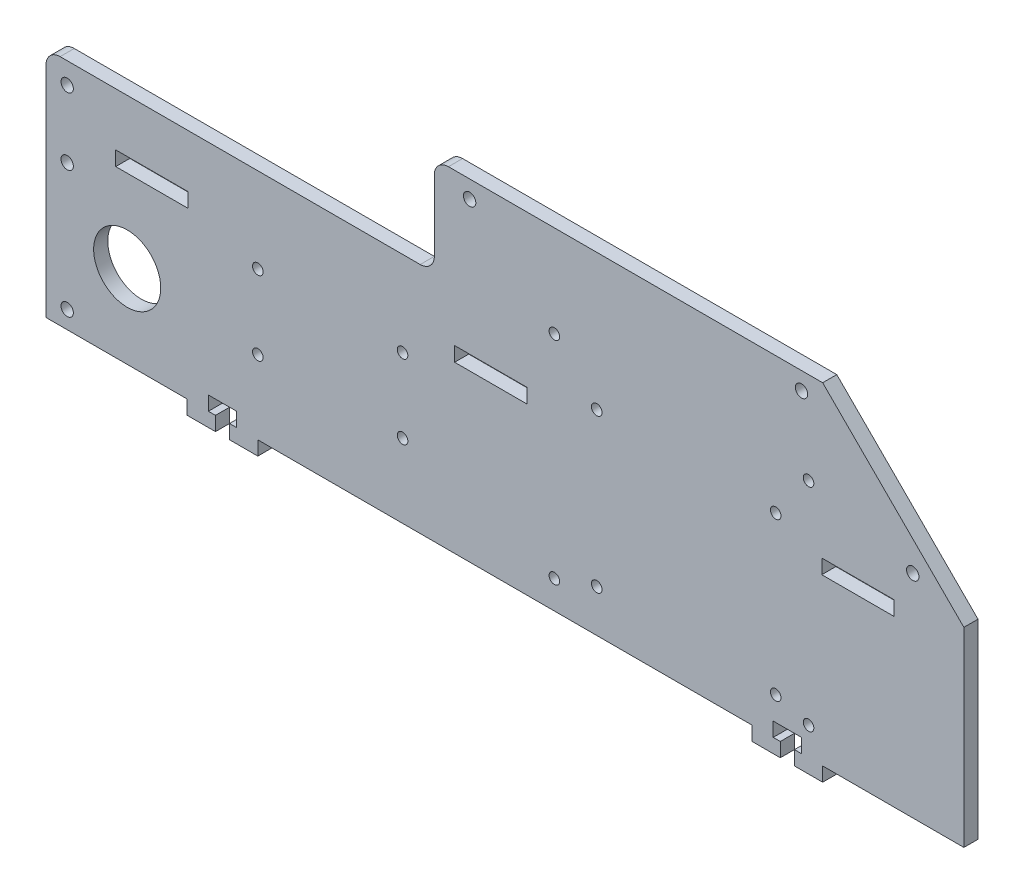
from build123d import *

# Parameters (mm, degrees)
SKETCH_1_R             = 9.5
SKETCH_1_R_2           = 1.5
SKETCH_1_W             = 20.5
SKETCH_1_H             = 4.1
SM_BASE_FLANGE_1_DEPTH = 4
SKETCH_6_R             = 1.75
CUT_EXTRUDE_1_DEPTH    = 267.640207021
SKETCH_8_R             = 1
SKETCH_8_R_2           = 0.822154456
CUT_EXTRUDE_3_DEPTH    = 10
CUT_EXTRUDE_4_REACH    = 268.64
SKETCH_9_R             = 1.5


# Sheet-metal steps are written as plain solids
with BuildPart() as part:
    # Sketch 1 → Базовая кромка1 (new body)
    with BuildSketch(Plane.XY):
        with BuildLine():
            Line((52, -59), (60, -59))
            Line((60, -59), (60, -55))
            Line((60, -55), (200, -55))
            Line((200, -55), (200, -59))
            Line((200, -59), (208, -59))
            Line((208, -59), (208, -55))
            Line((208, -55), (206, -55))
            Line((206, -55), (206, -51))
            Line((206, -51), (214, -51))
            Line((214, -51), (214, -55))
            Line((214, -55), (212, -55))
            Line((212, -55), (212, -59))
            Line((212, -59), (220, -59))
            Line((220, -59), (220, -55))
            Line((220, -55), (260, -55))
            Line((260, -55), (260, -1))
            Line((260, -1), (220, 39))
            Line((220, 39), (120, 39))
            Line((120, 39), (114, 39))
            ThreePointArc((114, 39), (111.171572875, 37.828427125), (110, 35))
            Line((110, 35), (110, 15))
            ThreePointArc((110, 15), (108.828427125, 12.171572875), (106, 11))
            Line((106, 11), (4, 11))
            ThreePointArc((4, 11), (1.171572875, 9.828427125), (0, 7))
            Line((0, 7), (0, 0))
            Line((0, 0), (0, -55))
            Line((0, -55), (40, -55))
            Line((40, -55), (40, -59))
            Line((40, -59), (48, -59))
            Line((48, -59), (48, -55))
            Line((48, -55), (46, -55))
            Line((46, -55), (46, -51))
            Line((46, -51), (54, -51))
            Line((54, -51), (54, -55))
            Line((54, -55), (52, -55))
            Line((52, -55), (52, -59))
        make_face()
        with Locations((23, -31.5)):
            Circle(SKETCH_1_R, mode=Mode.SUBTRACT)
        with Locations((156, -43)):
            Circle(SKETCH_1_R_2, mode=Mode.SUBTRACT)
        with Locations((206.7, 0.4)):
            Circle(SKETCH_1_R_2, mode=Mode.SUBTRACT)
        with Locations((156, 0.4)):
            Circle(SKETCH_1_R_2, mode=Mode.SUBTRACT)
        with Locations((206.7, -44.2)):
            Circle(SKETCH_1_R_2, mode=Mode.SUBTRACT)
        with Locations((144, -47)):
            Circle(SKETCH_1_R_2, mode=Mode.SUBTRACT)
        with Locations((216, -47)):
            Circle(SKETCH_1_R_2, mode=Mode.SUBTRACT)
        with Locations((216, 13)):
            Circle(SKETCH_1_R_2, mode=Mode.SUBTRACT)
        with Locations((144, 13)):
            Circle(SKETCH_1_R_2, mode=Mode.SUBTRACT)
        with Locations((30, -6.05)):
            Rectangle(SKETCH_1_W, SKETCH_1_H, mode=Mode.SUBTRACT)
        with Locations((230, -6.169027082)):
            Rectangle(SKETCH_1_W, SKETCH_1_H, mode=Mode.SUBTRACT)
        with Locations((126, -6.05)):
            Rectangle(SKETCH_1_W, SKETCH_1_H, mode=Mode.SUBTRACT)
    extrude(amount=-SM_BASE_FLANGE_1_DEPTH)

    # Эскиз6 → Вырез-Вытянуть1 (cut, through all)
    with BuildSketch(Plane.XY):
        with Locations((6, 5)):
            Circle(SKETCH_6_R)
        with Locations((120, 34)):
            Circle(SKETCH_6_R)
        with Locations((214, 34)):
            Circle(SKETCH_6_R)
        with Locations((245.514718626, 5)):
            Circle(SKETCH_6_R)
        with Locations((6, -14)):
            Circle(SKETCH_6_R)
        with Locations((6, -50)):
            Circle(SKETCH_6_R)
    extrude(amount=-CUT_EXTRUDE_1_DEPTH, mode=Mode.SUBTRACT)

    # Эскиз8 → Вырез-Вытянуть3 (cut)
    with BuildSketch(Plane.XZ.offset(55)):
        with Locations((210, -2)):
            Circle(SKETCH_8_R)
        with Locations((50, -2)):
            Circle(SKETCH_8_R_2)
    extrude(amount=-CUT_EXTRUDE_3_DEPTH, mode=Mode.SUBTRACT)

    # Эскиз9 → Вырез-Вытянуть4 (cut, up to next)
    with BuildSketch(Plane.XY, mode=Mode.PRIVATE) as cut_extrude_4_sk1:
        with Locations((60, -13.1)):
            Circle(SKETCH_9_R)
    cut_extrude_4_tool1 = extrude(cut_extrude_4_sk1.sketch, amount=-CUT_EXTRUDE_4_REACH, mode=Mode.PRIVATE) & part.part
    # Эскиз9 → Вырез-Вытянуть4 (cut, up to next)
    with BuildSketch(Plane.XY, mode=Mode.PRIVATE) as cut_extrude_4_sk2:
        with Locations((101, -34.1)):
            Circle(SKETCH_9_R)
    cut_extrude_4_tool2 = extrude(cut_extrude_4_sk2.sketch, amount=-CUT_EXTRUDE_4_REACH, mode=Mode.PRIVATE) & part.part
    # Эскиз9 → Вырез-Вытянуть4 (cut, up to next)
    with BuildSketch(Plane.XY, mode=Mode.PRIVATE) as cut_extrude_4_sk3:
        with Locations((101, -13.1)):
            Circle(SKETCH_9_R)
    cut_extrude_4_tool3 = extrude(cut_extrude_4_sk3.sketch, amount=-CUT_EXTRUDE_4_REACH, mode=Mode.PRIVATE) & part.part
    # Эскиз9 → Вырез-Вытянуть4 (cut, up to next)
    with BuildSketch(Plane.XY, mode=Mode.PRIVATE) as cut_extrude_4_sk4:
        with Locations((60, -34.1)):
            Circle(SKETCH_9_R)
    cut_extrude_4_tool4 = extrude(cut_extrude_4_sk4.sketch, amount=-CUT_EXTRUDE_4_REACH, mode=Mode.PRIVATE) & part.part
    add(cut_extrude_4_tool1.solids().sort_by_distance((60, -13.1, 0))[0], mode=Mode.SUBTRACT)
    add(cut_extrude_4_tool2.solids().sort_by_distance((101, -34.1, 0))[0], mode=Mode.SUBTRACT)
    add(cut_extrude_4_tool3.solids().sort_by_distance((101, -13.1, 0))[0], mode=Mode.SUBTRACT)
    add(cut_extrude_4_tool4.solids().sort_by_distance((60, -34.1, 0))[0], mode=Mode.SUBTRACT)


solid = part.part
